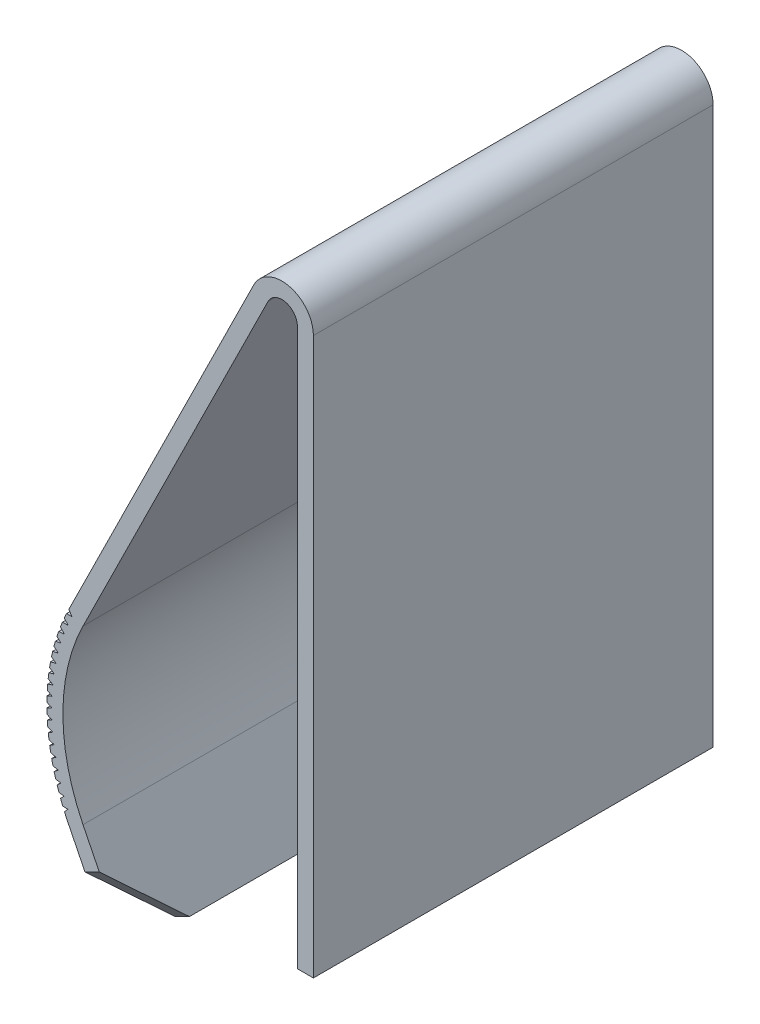
from build123d import *

# Parameters (mm, degrees)
EXTRUDE_THIN1_DEPTH = 7.62
CHAMFER1_SIZE       = 1.190625
CUT_EXTRUDE1_DEPTH  = 15.472853006
CRVPATTERN1_DEPTH   = 7.62


# Read off the part's stored shape, not the designer's step: CrvPattern1
with BuildPart() as part:
    # Sketch2 → Extrude-Thin1 (new body)
    with BuildSketch(Plane.XY):
        with BuildLine():
            Line((0, 0), (0, 10.606813737))
            ThreePointArc((0, 10.606813737), (-0.463285182, 11.191030357), (-1.137696862, 10.873050632))
            Line((-1.137696862, 10.873050632), (-4.664645747, 3.749960706))
            ThreePointArc((-4.664645747, 3.749960706), (-5.08, 1.975048069), (-4.664645747, 0.200135433))
            Line((-4.664645747, 0.200135433), (-3.82620918, -1.493186263))
            Line((-3.82620918, -1.493186263), (-3.553059174, -1.35793792))
            Line((-3.553059174, -1.35793792), (-4.391495741, 0.335383776))
            ThreePointArc((-4.391495741, 0.335383776), (-4.7752, 1.975048069), (-4.391495741, 3.614712363))
            Line((-4.391495741, 3.614712363), (-0.864546856, 10.737802289))
            ThreePointArc((-0.864546856, 10.737802289), (-0.53273631, 10.894248314), (-0.3048, 10.606813737))
            Line((-0.3048, 10.606813737), (-0.3048, 0))
            Line((-0.3048, 0), (0, 0))
        make_face()
    extrude(amount=EXTRUDE_THIN1_DEPTH)

    # Chamfer1
    chamfer1_edges = [part.edges().sort_by_distance(p)[0] for p in [
        (-3.689634177, -1.425562092, 0),
        (-3.689634177, -1.425562092, 7.62),
    ]]
    chamfer(chamfer1_edges, length=CHAMFER1_SIZE)

    # Sketch4 → Cut-Extrude1 (cut, through all)
    with BuildSketch(Plane.XY.offset(7.62)):
        with BuildLine():
            Line((-4.664645747, 3.749960706), (-4.596046712, 3.664267155))
            Line((-4.596046712, 3.664267155), (-4.705815616, 3.664267155))
            ThreePointArc((-4.705815616, 3.664267155), (-4.685485281, 3.707236248), (-4.664645747, 3.749960706))
        make_face()
    extrude(amount=-CUT_EXTRUDE1_DEPTH, mode=Mode.SUBTRACT)

    # CrvPattern1 outline → CrvPattern1 (cut)
    with BuildSketch(Plane.XY):
        with BuildLine():
            Line((-4.744975764, 0.372564793), (-4.680378039, 0.445121042))
            Line((-4.680378039, 0.445121042), (-4.777966042, 0.450237541))
            ThreePointArc((-4.777966042, 0.450237541), (-4.761675743, 0.411314165), (-4.744975764, 0.372564793))
        make_face()
        with BuildLine():
            ThreePointArc((-4.748910862, 3.568501265), (-4.767580416, 3.524806333), (-4.785729607, 3.48089271))
            Line((-4.785729607, 3.48089271), (-4.676162545, 3.486332727))
            Line((-4.676162545, 3.486332727), (-4.748910862, 3.568501265))
        make_face()
        with BuildLine():
            ThreePointArc((-4.824009644, 3.383022425), (-4.840450562, 3.338503815), (-4.856362147, 3.293793281))
            Line((-4.856362147, 3.293793281), (-4.747356217, 3.304644344))
            Line((-4.747356217, 3.304644344), (-4.824009644, 3.383022425))
        make_face()
        with BuildLine():
            ThreePointArc((-4.889747992, 3.19399033), (-4.903912846, 3.148798701), (-4.917541653, 3.103442532))
            Line((-4.917541653, 3.103442532), (-4.809452549, 3.119649065))
            Line((-4.809452549, 3.119649065), (-4.889747992, 3.19399033))
        make_face()
        with BuildLine():
            ThreePointArc((-4.945955852, 3.001880747), (-4.957808713, 2.956169664), (-4.969121106, 2.910321838))
            Line((-4.969121106, 2.910321838), (-4.862298748, 2.931802088))
            Line((-4.862298748, 2.931802088), (-4.945955852, 3.001880747))
        make_face()
        with BuildLine():
            ThreePointArc((-4.992487715, 2.807177794), (-5.002004339, 2.761102753), (-5.010978384, 2.714918968))
            Line((-5.010978384, 2.714918968), (-4.905764782, 2.741565627))
            Line((-4.905764782, 2.741565627), (-4.992487715, 2.807177794))
        make_face()
        with BuildLine():
            ThreePointArc((-5.02922305, 2.610372633), (-5.036390971, 2.564090075), (-5.043016507, 2.517726765))
            Line((-5.043016507, 2.517726765), (-4.939743698, 2.549407773))
            Line((-4.939743698, 2.549407773), (-5.02922305, 2.610372633))
        make_face()
        with BuildLine():
            ThreePointArc((-5.056066661, 2.411962141), (-5.060885198, 2.365628463), (-5.06516382, 2.319241812))
            Line((-5.06516382, 2.319241812), (-4.96415189, 2.355801348))
            Line((-4.96415189, 2.355801348), (-5.056066661, 2.411962141))
        make_face()
        with BuildLine():
            ThreePointArc((-5.07294897, 2.212447566), (-5.075429139, 2.166218137), (-5.077374093, 2.1199631))
            Line((-5.077374093, 2.1199631), (-4.978929297, 2.161222738))
            Line((-4.978929297, 2.161222738), (-5.07294897, 2.212447566))
        make_face()
        with BuildLine():
            ThreePointArc((-5.079826224, 2.012333162), (-5.079990568, 1.966361356), (-5.079626554, 1.920390698))
            Line((-5.079626554, 1.920390698), (-4.98403956, 1.966150718))
            Line((-4.98403956, 1.966150718), (-5.079826224, 2.012333162))
        make_face()
        with BuildLine():
            ThreePointArc((-5.076680625, 1.812124816), (-5.074562951, 1.766561064), (-5.071925849, 1.721024422))
            Line((-5.071925849, 1.721024422), (-4.979470103, 1.771065282))
            Line((-4.979470103, 1.771065282), (-5.076680625, 1.812124816))
        make_face()
        with BuildLine():
            ThreePointArc((-5.063520382, 1.612328668), (-5.059165421, 1.567319544), (-5.054301926, 1.522362527))
            Line((-5.054301926, 1.522362527), (-4.965232171, 1.576446452))
            Line((-4.965232171, 1.576446452), (-5.063520382, 1.612328668))
        make_face()
        with BuildLine():
            ThreePointArc((-5.040379693, 1.413449735), (-5.033842672, 1.369137078), (-5.026809852, 1.324900401))
            Line((-5.026809852, 1.324900401), (-4.941360798, 1.382773106))
            Line((-4.941360798, 1.382773106), (-5.040379693, 1.413449735))
        make_face()
        with BuildLine():
            ThreePointArc((-5.007318634, 1.215990531), (-4.998664778, 1.172510618), (-4.989529564, 1.129129286))
            Line((-4.989529564, 1.129129286), (-4.907914719, 1.190521793))
            Line((-4.907914719, 1.190521793), (-5.007318634, 1.215990531))
        make_face()
        with BuildLine():
            ThreePointArc((-4.964422988, 1.020449699), (-4.953726948, 0.977932464), (-4.942565548, 0.935535016))
            Line((-4.942565548, 0.935535016), (-4.864976234, 1.000165564))
            Line((-4.864976234, 1.000165564), (-4.964422988, 1.020449699))
        make_face()
        with BuildLine():
            ThreePointArc((-4.911803987, 0.827320662), (-4.899149207, 0.785888981), (-4.886046457, 0.744596783))
            Line((-4.886046457, 0.744596783), (-4.812650995, 0.812172807))
            Line((-4.812650995, 0.812172807), (-4.911803987, 0.827320662))
        make_face()
        with BuildLine():
            ThreePointArc((-4.849597983, 0.63709028), (-4.835076, 0.596859317), (-4.820124666, 0.556785934))
            Line((-4.820124666, 0.556785934), (-4.751067753, 0.627006093))
            Line((-4.751067753, 0.627006093), (-4.849597983, 0.63709028))
        make_face()
    extrude(amount=CRVPATTERN1_DEPTH, mode=Mode.SUBTRACT)


solid = part.part
